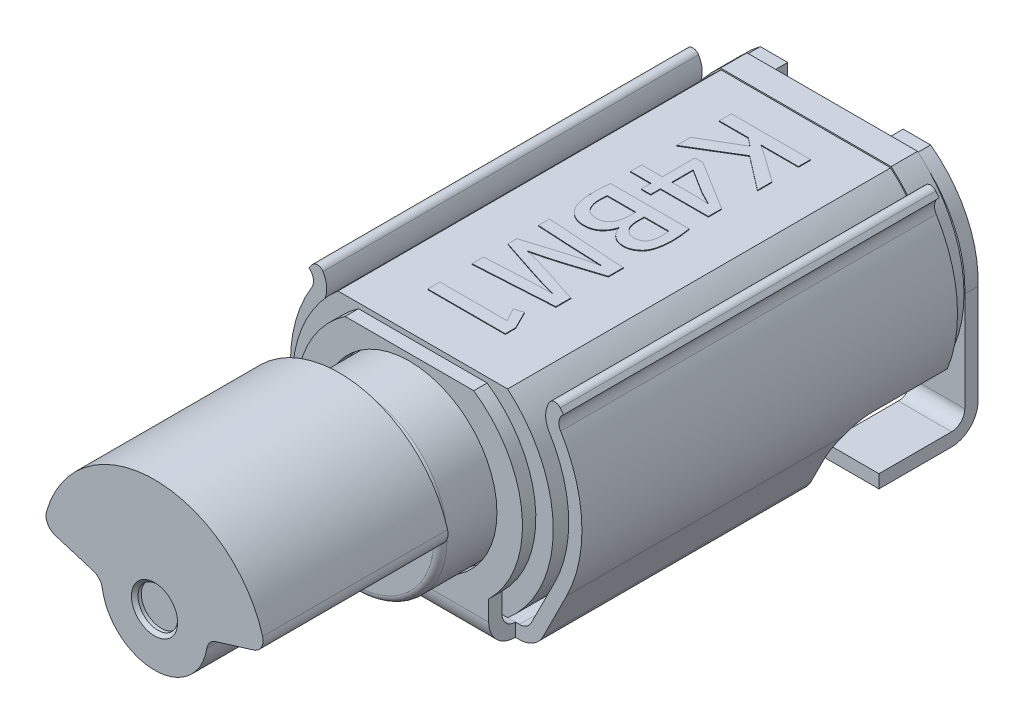
from build123d import *

# Parameters (mm, degrees)
BOSS_EXTRUDE1_DEPTH     = 6.5
CUT_EXTRUDE1_DEPTH      = 8.678373415
CUT_EXTRUDE1_DEPTH_BACK = 8.678373415
SKETCH2_W               = 0.404960927
SKETCH2_H               = 3.440393314
BOSS_EXTRUDE2_DEPTH     = 1.2
BOSS_EXTRUDE3_DEPTH     = 0.202480463
SKETCH7_W               = 0.9
SKETCH7_H               = 0.2
BOSS_EXTRUDE4_DEPTH     = 1.6
FILLET1_R               = 0.4
FILLET2_R               = 0.2
FILLET3_R               = 0.1
FILLET4_R               = 0.4
BOSS_EXTRUDE5_DEPTH     = 5.8
SKETCH11_R              = 0.35
BOSS_EXTRUDE6_DEPTH     = 2.8
SKETCH12_R              = 0.3
CUT_EXTRUDE2_DEPTH      = 0.1
CHAMFER1_SIZE           = 0.05
FILLET5_R               = 0.2
BOSS_EXTRUDE7_DEPTH     = 0.4
SKETCH14_R              = 0.322221407
SKETCH14_R_2            = 0.196605944
SKETCH14_R_3            = 0.3
BOSS_EXTRUDE8_DEPTH     = 0.4
SKETCH15_R              = 0.225672788
BOSS_EXTRUDE9_DEPTH     = 0.2
SKETCH16_W              = 0.807059616
SKETCH16_H              = 0.2
BOSS_EXTRUDE10_DEPTH    = 1.3
FILLET6_R               = 0.2
FILLET7_R               = 0.4
CHAMFER2_SIZE           = 0.05
WRAP1_DEPTH             = 0.01


# Read off the part's stored shape, not the designer's step: Wrap1
with BuildPart() as part:
    # Sketch1 → Boss-Extrude1 (new body)
    with BuildSketch(Plane.XY):
        with BuildLine():
            Line((-1.508880981, 0), (0, 0))
            Line((0, 0), (1.508880981, 0))
            Line((1.508880981, 0), (1.976611203, 0.933111573))
            ThreePointArc((1.976611203, 0.933111573), (2.205012611, 2.001424728), (1.884851065, 3.045913495))
            ThreePointArc((1.884851065, 3.045913495), (1.861209786, 3.172245294), (1.928161236, 3.281954623))
            Line((1.928161236, 3.281954623), (1.806107227, 3.440393314))
            ThreePointArc((1.806107227, 3.440393314), (1.664493793, 3.208339865), (1.714499023, 2.941127131))
            ThreePointArc((1.714499023, 2.941127131), (2.005200965, 1.992746799), (1.79781587, 1.022734276))
            Line((1.79781587, 1.022734276), (1.385413219, 0.2))
            Line((1.385413219, 0.2), (0, 0.2))
            Line((0, 0.2), (-1.385413219, 0.2))
            Line((-1.385413219, 0.2), (-1.79781587, 1.022734276))
            ThreePointArc((-1.79781587, 1.022734276), (-2.005200965, 1.992746799), (-1.714499023, 2.941127131))
            ThreePointArc((-1.714499023, 2.941127131), (-1.664493793, 3.208339865), (-1.806107227, 3.440393314))
            Line((-1.806107227, 3.440393314), (-1.928161236, 3.281954623))
            ThreePointArc((-1.928161236, 3.281954623), (-1.861209786, 3.172245294), (-1.884851065, 3.045913495))
            ThreePointArc((-1.884851065, 3.045913495), (-2.205012611, 2.001424728), (-1.976611203, 0.933111573))
            Line((-1.976611203, 0.933111573), (-1.508880981, 0))
        make_face()
    extrude(amount=BOSS_EXTRUDE1_DEPTH)

    # Sketch2 → Cut-Extrude1 (cut, two sides: drawn at the far end of the back side and taken through both)
    with BuildSketch(Plane(origin=(0, 0, 0), x_dir=(0, 0, -1), z_dir=(1, 0, 0)).offset(-CUT_EXTRUDE1_DEPTH_BACK)):
        with Locations((-6.297519537, 1.720196657)):
            Rectangle(SKETCH2_W, SKETCH2_H)
        with BuildLine():
            Line((-2.039263389, 0), (-2.039263389, 0.604078282))
            ThreePointArc((-2.039263389, 0.604078282), (-1.89281678, 0.957631672), (-1.539263389, 1.104078282))
            Line((-1.539263389, 1.104078282), (-0.407698677, 1.104078282))
            Line((-0.407698677, 1.104078282), (-0.407698677, 3.440393314))
            Line((-0.407698677, 3.440393314), (0, 3.440393314))
            Line((0, 3.440393314), (0, 0))
            Line((0, 0), (-2.039263389, 0))
        make_face()
    extrude(amount=CUT_EXTRUDE1_DEPTH + CUT_EXTRUDE1_DEPTH_BACK, mode=Mode.SUBTRACT)

    # Sketch5 → Boss-Extrude2 (add, symmetric)
    with BuildSketch(Plane(origin=(0, 0, 0), x_dir=(0, 0, -1), z_dir=(1, 0, 0))):
        Polygon((-6.095039073, 0), (-6.5, 0), (-6.5, 0.5), (-6.297519537, 0.5), (-6.297519537, 0.2), (-6.095039073, 0.2), align=None)
    extrude(amount=BOSS_EXTRUDE2_DEPTH, both=True)

    # Sketch6 → Boss-Extrude3 (add)
    with BuildSketch(Plane.XY.offset(6.5)):
        with BuildLine():
            Line((-1.2, 0.705707789), (-1.2, 0.5))
            Line((-1.2, 0.5), (0, 0.5))
            Line((0, 0.5), (0, 0.57516784))
            ThreePointArc((0, 0.57516784), (-1.325, 1.90016784), (0, 3.22516784))
            Line((0, 3.22516784), (0, 3.323129085))
            Line((0, 3.323129085), (-0.973891978, 3.323129085))
            ThreePointArc((-0.973891978, 3.323129085), (-1.705524405, 2.067854826), (-1.2, 0.705707789))
        make_face()
        with BuildLine():
            Line((0, 0.57516784), (0, 0.5))
            Line((0, 0.5), (1.2, 0.5))
            Line((1.2, 0.5), (1.2, 0.705707789))
            ThreePointArc((1.2, 0.705707789), (1.705524405, 2.067854826), (0.973891978, 3.323129085))
            Line((0.973891978, 3.323129085), (0, 3.323129085))
            Line((0, 3.323129085), (0, 3.22516784))
            ThreePointArc((0, 3.22516784), (0.936916485, 2.837084325), (1.325, 1.90016784))
            ThreePointArc((1.325, 1.90016784), (0.936916485, 0.963251355), (0, 0.57516784))
        make_face()
    extrude(amount=-BOSS_EXTRUDE3_DEPTH)

    # Sketch7 → Boss-Extrude4 (add)
    with BuildSketch(Plane(origin=(0, 0, 2.039263389), x_dir=(-1, 0, 0), z_dir=(0, 0, -1))):
        with Locations((0, 0.1)):
            Rectangle(SKETCH7_W, SKETCH7_H)
    extrude(amount=BOSS_EXTRUDE4_DEPTH)

    # Fillet1
    fillet1_edges = [part.edges().sort_by_distance(p)[0] for p in [
        (0, 0, 6.5),
        (1.508880981, 0, 4.067151231),
        (-1.508880981, 0, 4.067151231),
    ]]
    fillet(fillet1_edges, radius=FILLET1_R)

    # Fillet2
    fillet2_edges = [part.edges().sort_by_distance(p)[0] for p in [
        (0, 0.2, 6.297519537),
        (-1.385413219, 0.2, 4.067151231),
        (1.385413219, 0.2, 4.067151231),
    ]]
    fillet(fillet2_edges, radius=FILLET2_R)

    # Fillet3
    fillet3_edges = [part.edges().sort_by_distance(p)[0] for p in [
        (-1.806107227, 3.440393314, 3.251368875),
        (1.806107227, 3.440393314, 3.251368875),
    ]]
    fillet(fillet3_edges, radius=FILLET3_R)

    # Fillet4
    fillet4_edges = [part.edges().sort_by_distance(p)[0] for p in [
        (0.45, 0.1, 2.039263389),
        (-0.45, 0.1, 2.039263389),
    ]]
    fillet(fillet4_edges, radius=FILLET4_R)

    # Sketch9 → Boss-Extrude5 (add)
    with BuildSketch(Plane(origin=(0, 0, 6.297519537), x_dir=(-1, 0, 0), z_dir=(0, 0, -1))):
        with BuildLine():
            Line((1.284766516, 3.40016784), (-1.284766516, 3.40016784))
            ThreePointArc((-1.284766516, 3.40016784), (-1.975, 1.90016784), (-1.284766516, 0.40016784))
            Line((-1.284766516, 0.40016784), (1.284766516, 0.40016784))
            ThreePointArc((1.284766516, 0.40016784), (1.975, 1.90016784), (1.284766516, 3.40016784))
        make_face()
    extrude(amount=BOSS_EXTRUDE5_DEPTH)

    # Sketch10 → Revolve1 (revolve)
    with BuildSketch(Plane(origin=(0, 0, 0), x_dir=(0, 0, -1), z_dir=(1, 0, 0)), mode=Mode.PRIVATE) as revolve1_sk:
        with BuildLine():
            Line((-6.297519537, 3.20016784), (-7.230821667, 3.20016784))
            ThreePointArc((-7.230821667, 3.20016784), (-7.301532345, 3.170878518), (-7.330821667, 3.10016784))
            Line((-7.330821667, 3.10016784), (-7.330821667, 2.25016784))
            Line((-7.330821667, 2.25016784), (-10.359848514, 2.25016784))
            Line((-10.359848514, 2.25016784), (-10.359848514, 1.90016784))
            Line((-10.359848514, 1.90016784), (-6.297519537, 1.90016784))
            Line((-6.297519537, 1.90016784), (-6.297519537, 3.20016784))
        make_face()
    revolve(revolve1_sk.sketch.rotate(Axis((0, 1.90016784, 10.359848514), (0, 0, -1)), 180), axis=Axis((0, 1.90016784, 10.359848514), (0, 0, -1)))

    # Sketch11 → Boss-Extrude6 (add)
    with BuildSketch(Plane.XY.offset(10.359848514)):
        with BuildLine():
            Line((0.8, 1.90016784), (1.678413738, 2.170218436))
            ThreePointArc((1.678413738, 2.170218436), (0, 3.60016784), (-1.678413738, 2.170218436))
            Line((-1.678413738, 2.170218436), (-0.8, 1.90016784))
            ThreePointArc((-0.8, 1.90016784), (0, 1.10016784), (0.8, 1.90016784))
        make_face()
        with Locations(Location((0, 1.90016784, 0), (0, 0, 270))):
            Circle(SKETCH11_R, mode=Mode.SUBTRACT)
    extrude(amount=-BOSS_EXTRUDE6_DEPTH)

    # Sketch12 → Cut-Extrude2 (cut)
    with BuildSketch(Plane.XY.offset(10.359848514)):
        with Locations((0, 1.90016784)):
            Circle(SKETCH12_R)
    extrude(amount=-CUT_EXTRUDE2_DEPTH, mode=Mode.SUBTRACT)

    # Chamfer1
    chamfer1_edges = [part.edges().sort_by_distance(p)[0] for p in [
        (-0.3, 1.90016784, 10.359848514),
    ]]
    chamfer(chamfer1_edges, length=CHAMFER1_SIZE)

    # Fillet5
    fillet5_edges = [part.edges().sort_by_distance(p)[0] for p in [
        (0.8, 1.90016784, 8.959848514),
        (-0.8, 1.90016784, 8.959848514),
        (-1.678413738, 2.170218436, 8.959848514),
        (1.678413738, 2.170218436, 8.959848514),
    ]]
    fillet(fillet5_edges, radius=FILLET5_R)

    # Sketch13 → Boss-Extrude7 (add)
    with BuildSketch(Plane(origin=(0, 0, 0.497519537), x_dir=(-1, 0, 0), z_dir=(0, 0, -1))):
        with BuildLine():
            Line((1.292139698, 3.42016784), (-1.292139698, 3.42016784))
            ThreePointArc((-1.292139698, 3.42016784), (-1.995, 1.90016784), (-1.292139698, 0.38016784))
            Line((-1.292139698, 0.38016784), (1.292139698, 0.38016784))
            ThreePointArc((1.292139698, 0.38016784), (1.995, 1.90016784), (1.292139698, 3.42016784))
        make_face()
    extrude(amount=BOSS_EXTRUDE7_DEPTH)

    # Sketch14 → Boss-Extrude8 (add)
    # profile 1 of 4: a face of its own
    with BuildSketch(Plane(origin=(0, 0, 0.097519537), x_dir=(-1, 0, 0), z_dir=(0, 0, -1))):
        with BuildLine():
            Line((0.874363241, 2.446594123), (0.874363241, 1.353741556))
            ThreePointArc((0.874363241, 1.353741556), (0, 0.869103942), (-0.874363241, 1.353741556))
            Line((-0.874363241, 1.353741556), (-0.874363241, 2.446594123))
            ThreePointArc((-0.874363241, 2.446594123), (0, 2.931231737), (0.874363241, 2.446594123))
        make_face()
        with Locations((0, 1.90016784)):
            Circle(SKETCH14_R, mode=Mode.SUBTRACT)
    # profile 2 of 4: a face of its own
    with BuildSketch(Plane(origin=(0, 0, 0.097519537), x_dir=(-1, 0, 0), z_dir=(0, 0, -1))):
        with Locations((1.305297869, 2.606990559)):
            Circle(SKETCH14_R_2)
    # profile 3 of 4: a face of its own
    with BuildSketch(Plane(origin=(0, 0, 0.097519537), x_dir=(-1, 0, 0), z_dir=(0, 0, -1))):
        with Locations((-1.319866553, 1.220938008)):
            Circle(SKETCH14_R_2)
    # profile 4 of 4: a face of its own
    with BuildSketch(Plane(origin=(0, 0, 0.097519537), x_dir=(-1, 0, 0), z_dir=(0, 0, -1))):
        with Locations(Location((0, 1.90016784, 0), (0, 0, 180))):
            Circle(SKETCH14_R_3)
    extrude(amount=BOSS_EXTRUDE8_DEPTH)

    # Sketch15 → Boss-Extrude9 (add)
    # profile 1 of 2: a face of its own
    with BuildSketch(Plane(origin=(0, 0, 0.097519537), x_dir=(-1, 0, 0), z_dir=(0, 0, -1))):
        with BuildLine():
            Line((-0.874363241, 1.353741556), (-0.874363241, 3.40271883))
            Line((-0.874363241, 3.40271883), (-1.289526835, 3.40271883))
            ThreePointArc((-1.289526835, 3.40271883), (-1.834590395, 2.744294855), (-2.007059616, 1.907114599))
            Line((-2.007059616, 1.907114599), (-2.007059616, 0))
            Line((-2.007059616, 0), (-1.2, 0))
            Line((-1.2, 0), (-1.2, 0.502925736))
            ThreePointArc((-1.2, 0.502925736), (-1.112132034, 0.715057771), (-0.9, 0.802925736))
            Line((-0.9, 0.802925736), (-0.787371765, 0.802925736))
            ThreePointArc((-0.787371765, 0.802925736), (-0.716661087, 0.832215058), (-0.687371765, 0.902925736))
            Line((-0.687371765, 0.902925736), (-0.687371765, 1.131654459))
            ThreePointArc((-0.687371765, 1.131654459), (-0.78872348, 1.236083483), (-0.874363241, 1.353741556))
        make_face()
        with Locations((-1.319866553, 1.220938008)):
            Circle(SKETCH15_R, mode=Mode.SUBTRACT)
    # profile 2 of 2: a face of its own
    with BuildSketch(Plane(origin=(0, 0, 0.097519537), x_dir=(-1, 0, 0), z_dir=(0, 0, -1))):
        with BuildLine():
            Line((0.874363241, 1.353741556), (0.874363241, 3.40271883))
            Line((0.874363241, 3.40271883), (1.289526835, 3.40271883))
            ThreePointArc((1.289526835, 3.40271883), (1.834590395, 2.744294855), (2.007059616, 1.907114599))
            Line((2.007059616, 1.907114599), (2.007059616, 0))
            Line((2.007059616, 0), (1.2, 0))
            Line((1.2, 0), (1.2, 0.502925736))
            ThreePointArc((1.2, 0.502925736), (1.112132034, 0.715057771), (0.9, 0.802925736))
            Line((0.9, 0.802925736), (0.787371765, 0.802925736))
            ThreePointArc((0.787371765, 0.802925736), (0.716661087, 0.832215058), (0.687371765, 0.902925736))
            Line((0.687371765, 0.902925736), (0.687371765, 1.131654459))
            ThreePointArc((0.687371765, 1.131654459), (0.78872348, 1.236083483), (0.874363241, 1.353741556))
        make_face()
        with Locations((1.305297869, 2.606990559)):
            Circle(SKETCH15_R, mode=Mode.SUBTRACT)
    extrude(amount=BOSS_EXTRUDE9_DEPTH)

    # Sketch16 → Boss-Extrude10 (add)
    with BuildSketch(Plane.XY.offset(0.097519537)):
        with Locations((-1.603529808, 0.1)):
            Rectangle(SKETCH16_W, SKETCH16_H)
        with Locations((1.603529808, 0.1)):
            Rectangle(SKETCH16_W, SKETCH16_H)
    extrude(amount=BOSS_EXTRUDE10_DEPTH)

    # Fillet6
    # the kernel refuses this fillet: 0.2 mm, written as the material it adds along each edge
    with BuildSketch(Plane(origin=(-1.2, 0.2, 0.097519537), x_dir=(0, 1, 0), z_dir=(-1, 0, 0))) as fillet6_piece_1:
        with BuildLine():
            CenterArc((FILLET6_R, -FILLET6_R), FILLET6_R, 90, 90)
            Line((0, -FILLET6_R), (0, 0))
            Line((0, 0), (FILLET6_R, 0))
        make_face()
    extrude(amount=0.807059616)
    with BuildSketch(Plane(origin=(1.2, 0.2, 0.097519537), x_dir=(0, 1, 0), z_dir=(1, 0, 0))) as fillet6_piece_2:
        with BuildLine():
            CenterArc((FILLET6_R, FILLET6_R), FILLET6_R, 180, 90)
            Line((0, FILLET6_R), (0, 0))
            Line((0, 0), (FILLET6_R, 0))
        make_face()
    extrude(amount=0.807059616)

    # Fillet7
    fillet7_edges = [part.edges().sort_by_distance(p)[0] for p in [
        (1.603529808, 0, -0.102480463),
        (-1.603529808, 0, -0.102480463),
    ]]
    fillet(fillet7_edges, radius=FILLET7_R)

    # Chamfer2
    chamfer2_edges = [part.edges().sort_by_distance(p)[0] for p in [
        (-0.3, 1.90016784, -0.302480463),
    ]]
    chamfer(chamfer2_edges, length=CHAMFER2_SIZE)

    # Wrap1 outline → Wrap1 (add)
    # profile 1 of 5: a face of its own
    with BuildSketch(Plane(origin=(0, 3.40016784, 0), x_dir=(1, 0, 0), z_dir=(0, 1, 0))):
        with BuildLine():
            Line((0.580006511, -1.589035731), (0.150238548, -1.280263442))
            add(Edge.make_bspline(
                [(0.150238548, -1.280263442), (0.128647408, -1.265784022), (0.084655949, -1.236282533), (0.039655444, -1.208343991), (0.016741322, -1.194117769)],
                knots=[0, 0, 0, 0, 0.490803005, 1, 1, 1, 1], degree=3))
            Line((0.016741322, -1.194117769), (0.016898989, -1.189355864))
            Line((0.016898989, -1.189355864), (0.580006511, -1.189355864))
            Line((0.580006511, -1.189355864), (0.580006511, -1.005228624))
            Line((0.580006511, -1.005228624), (-0.619993489, -1.005228624))
            Line((-0.619993489, -1.005228624), (-0.619993489, -1.189355864))
            Line((-0.619993489, -1.189355864), (-0.179188596, -1.189355864))
            Line((-0.179188596, -1.189355864), (-0.053692541, -1.289667674))
            Line((-0.053692541, -1.289667674), (-0.619993489, -1.621950544))
            Line((-0.619993489, -1.621950544), (-0.619993489, -1.833545768))
            Line((-0.619993489, -1.833545768), (0.068666112, -1.416624808))
            Line((0.068666112, -1.416624808), (0.580006511, -1.810035188))
            Line((0.580006511, -1.810035188), (0.580006511, -1.589035731))
        make_face()
    # profile 2 of 5: a face of its own
    with BuildSketch(Plane(origin=(0, 3.40016784, 0), x_dir=(1, 0, 0), z_dir=(0, 1, 0))):
        with BuildLine():
            add(Edge.make_bspline(
                [(0.024005974, -3.349503212), (0.026979131, -3.357698037), (0.032791256, -3.373717824), (0.04339851, -3.396396838), (0.054668003, -3.417746101), (0.067471196, -3.437387277), (0.081057724, -3.455889499), (0.09578692, -3.472931528), (0.111705141, -3.488427154), (0.128710496, -3.502199355), (0.146506198, -3.514457072), (0.164801832, -3.525444377), (0.183876125, -3.5345205), (0.203592024, -3.541726341), (0.223757824, -3.547786615), (0.244664447, -3.551726186), (0.266108434, -3.554345145), (0.280603419, -3.554706303), (0.287943186, -3.55488918)],
                knots=[0, 0, 0, 0, 0.072925694, 0.142559987, 0.209357685, 0.274811788, 0.338581105, 0.401366938, 0.463105034, 0.524263478, 0.584279167, 0.643843037, 0.702700585, 0.760750232, 0.819406848, 0.878711473, 0.938583619, 1, 1, 1, 1], degree=3))
            add(Edge.make_bspline(
                [(0.287943186, -3.55488918), (0.296262217, -3.555251163), (0.313015632, -3.555980148), (0.338182361, -3.553212983), (0.363419557, -3.548122448), (0.38838995, -3.539462738), (0.413593156, -3.528326633), (0.438626102, -3.513959469), (0.463663835, -3.496759117), (0.488857405, -3.476992188), (0.512965737, -3.45263598), (0.533560504, -3.421847808), (0.551064685, -3.385410303), (0.566058791, -3.343479963), (0.577470588, -3.295676114), (0.586835337, -3.242393013), (0.592751413, -3.1831966), (0.594507913, -3.141824925), (0.595426236, -3.120195222)],
                knots=[0, 0, 0, 0, 0.041411388, 0.083396993, 0.125696939, 0.169380999, 0.21470772, 0.262749144, 0.312861918, 0.365885607, 0.422050724, 0.482709173, 0.549371117, 0.622950342, 0.704017343, 0.793808662, 0.892200225, 1, 1, 1, 1], degree=3))
            add(Edge.make_bspline(
                [(0.595426236, -3.120195222), (0.595003583, -3.093201994), (0.594177529, -3.040445146), (0.589528265, -2.975654541), (0.584286861, -2.926731456), (0.580129661, -2.89320341), (0.575069333, -2.86253552), (0.571351926, -2.843090635), (0.569575891, -2.833800612)],
                knots=[0, 0, 0, 0, 0.281194462, 0.549579805, 0.676274439, 0.793767423, 0.901469944, 1, 1, 1, 1], degree=3))
            Line((0.569575891, -2.833800612), (-0.62110336, -2.83380039))
            add(Edge.make_bspline(
                [(-0.62110336, -2.83380039), (-0.622149488, -2.840898643), (-0.624359289, -2.855892734), (-0.626684471, -2.879815251), (-0.629054388, -2.906260128), (-0.630665728, -2.935387427), (-0.632664792, -2.967116701), (-0.633860255, -3.001522058), (-0.635105791, -3.038479756), (-0.635457951, -3.063958278), (-0.635639751, -3.077111314)],
                knots=[0, 0, 0, 0, 0.088238411, 0.186391627, 0.29556366, 0.414798057, 0.545169041, 0.686594205, 0.838207345, 1, 1, 1, 1], degree=3))
            add(Edge.make_bspline(
                [(-0.635639751, -3.077111314), (-0.635659844, -3.089055883), (-0.635699281, -3.112500148), (-0.634129967, -3.14696831), (-0.632294955, -3.180110655), (-0.629058402, -3.211868427), (-0.624945555, -3.242175974), (-0.620297374, -3.271192529), (-0.614385529, -3.298716979), (-0.607617022, -3.324910329), (-0.599817959, -3.349598302), (-0.591636169, -3.373051667), (-0.581921792, -3.394909665), (-0.571628073, -3.415504408), (-0.560260663, -3.43473532), (-0.547707285, -3.452316816), (-0.534637765, -3.468847693), (-0.524992668, -3.478775183), (-0.520220228, -3.483687353)],
                knots=[0, 0, 0, 0, 0.082672515, 0.162265912, 0.238802977, 0.312420989, 0.383163987, 0.450516937, 0.515784915, 0.577970481, 0.637713091, 0.694977861, 0.74980512, 0.803156958, 0.85430552, 0.904243471, 0.952619211, 1, 1, 1, 1], degree=3))
            add(Edge.make_bspline(
                [(-0.520220228, -3.483687353), (-0.514673573, -3.489488077), (-0.503066861, -3.501626443), (-0.482191785, -3.518068515), (-0.458175166, -3.534611201), (-0.430590627, -3.550845219), (-0.398818332, -3.565185226), (-0.362157897, -3.575053038), (-0.321302593, -3.582002037), (-0.29243639, -3.583258191), (-0.27736304, -3.583914129)],
                knots=[0, 0, 0, 0, 0.088975791, 0.186187243, 0.294154312, 0.412566051, 0.54100935, 0.679628949, 0.832708687, 1, 1, 1, 1], degree=3))
            add(Edge.make_bspline(
                [(-0.27736304, -3.583914129), (-0.267074273, -3.583441918), (-0.24704344, -3.582522588), (-0.217817574, -3.578965024), (-0.190290204, -3.573047053), (-0.164371748, -3.565078046), (-0.139962603, -3.555345381), (-0.117117197, -3.543618274), (-0.096235095, -3.529372809), (-0.076897478, -3.51348646), (-0.059342269, -3.495998053), (-0.043245701, -3.477631631), (-0.028607921, -3.458520781), (-0.015676986, -3.438490798), (-0.004220347, -3.417637115), (0.00517231, -3.395674601), (0.013538852, -3.373123473), (0.01748508, -3.357501438), (0.019462411, -3.349673723)],
                knots=[0, 0, 0, 0, 0.075367478, 0.146730242, 0.21519733, 0.281169393, 0.344964617, 0.407318749, 0.468693359, 0.52960999, 0.59024462, 0.64983298, 0.708254302, 0.766257657, 0.824184453, 0.882153502, 0.940950796, 1, 1, 1, 1], degree=3))
            Line((0.019462411, -3.349673723), (0.024005974, -3.349503212))
        make_face()
        with BuildLine():
            Line((-0.055367756, -3.01792763), (-0.055367756, -3.124884938))
            add(Edge.make_bspline(
                [(-0.055367756, -3.124884938), (-0.055507593, -3.133754716), (-0.055783689, -3.151267385), (-0.057695982, -3.177154842), (-0.061724606, -3.202101256), (-0.066728946, -3.226284867), (-0.074001205, -3.249436629), (-0.082184007, -3.272014857), (-0.092611054, -3.293574889), (-0.104094632, -3.314375025), (-0.117694135, -3.333534819), (-0.133406554, -3.350566792), (-0.151576206, -3.364878148), (-0.171643073, -3.377016465), (-0.193922064, -3.386600244), (-0.218314291, -3.393545368), (-0.244783608, -3.398084343), (-0.263135183, -3.399207681), (-0.272601135, -3.399787111)],
                knots=[0, 0, 0, 0, 0.067331507, 0.132940679, 0.196800637, 0.259031592, 0.320195499, 0.380832412, 0.441142733, 0.501774217, 0.560999563, 0.619048845, 0.677021524, 0.735959941, 0.796604997, 0.860519054, 0.928054137, 1, 1, 1, 1], degree=3))
            add(Edge.make_bspline(
                [(-0.272601135, -3.399787111), (-0.282142716, -3.399292013), (-0.300563041, -3.39833621), (-0.327140275, -3.393922324), (-0.351652727, -3.387468939), (-0.374193002, -3.378623998), (-0.394499039, -3.367170563), (-0.41281999, -3.35355035), (-0.428915827, -3.337359296), (-0.442843923, -3.319033433), (-0.454754505, -3.298949442), (-0.46524696, -3.277808036), (-0.474077399, -3.255499286), (-0.481362045, -3.232171744), (-0.486796576, -3.207659727), (-0.490559387, -3.182121609), (-0.492974972, -3.155465082), (-0.492997738, -3.137358542), (-0.493009339, -3.128131732)],
                knots=[0, 0, 0, 0, 0.072289283, 0.139556765, 0.203550895, 0.263910766, 0.322329614, 0.37955626, 0.436207749, 0.494581733, 0.553369405, 0.612744635, 0.673104506, 0.734827098, 0.797581015, 0.862974822, 0.930174111, 1, 1, 1, 1], degree=3))
            add(Edge.make_bspline(
                [(-0.493009339, -3.128131732), (-0.493010083, -3.117019106), (-0.493011485, -3.096071949), (-0.491866972, -3.066578302), (-0.49004151, -3.040900304), (-0.487726768, -3.025174231), (-0.486660131, -3.01792763)],
                knots=[0, 0, 0, 0, 0.30164842, 0.56860339, 0.801211705, 1, 1, 1, 1], degree=3))
            Line((-0.486660131, -3.01792763), (-0.055367756, -3.01792763))
        make_face(mode=Mode.SUBTRACT)
        with BuildLine():
            Line((0.073430454, -3.01792763), (0.443319845, -3.01792763))
            add(Edge.make_bspline(
                [(0.443319845, -3.01792763), (0.444009533, -3.020794041), (0.445507428, -3.027019435), (0.447377034, -3.037373666), (0.448509982, -3.049521186), (0.449998468, -3.063410356), (0.451038377, -3.07899292), (0.452045633, -3.096374089), (0.452322943, -3.11550993), (0.452634098, -3.12888803), (0.452795824, -3.135841484)],
                knots=[0, 0, 0, 0, 0.0746234, 0.162070275, 0.266022372, 0.383294734, 0.515656155, 0.661265535, 0.823938053, 1, 1, 1, 1], degree=3))
            add(Edge.make_bspline(
                [(0.452795824, -3.135841484), (0.452740764, -3.150681274), (0.452633678, -3.17954291), (0.445812613, -3.221657825), (0.434038452, -3.261031424), (0.420105011, -3.291753549), (0.405582357, -3.313839953), (0.392628288, -3.328565249), (0.377135797, -3.340918239), (0.359525755, -3.351129138), (0.339840008, -3.359279432), (0.31809535, -3.365455883), (0.294103867, -3.369178787), (0.277373144, -3.370220303), (0.268668806, -3.370762162)],
                knots=[0, 0, 0, 0, 0.130735434, 0.254264952, 0.374702623, 0.492513413, 0.550205568, 0.607344188, 0.664715711, 0.724175948, 0.786333472, 0.852178839, 0.923094464, 1, 1, 1, 1], degree=3))
            add(Edge.make_bspline(
                [(0.268668806, -3.370762162), (0.261625743, -3.370448467), (0.247773818, -3.36983151), (0.227519504, -3.366519257), (0.208152814, -3.361780517), (0.190091363, -3.354261015), (0.172991332, -3.34517109), (0.156768881, -3.334279106), (0.141728978, -3.321231804), (0.127967352, -3.306264649), (0.115474039, -3.289610841), (0.104258186, -3.271490179), (0.095052119, -3.251631327), (0.087347067, -3.230462672), (0.081081873, -3.207817586), (0.077061363, -3.183559353), (0.07387537, -3.157917418), (0.073431143, -3.140311776), (0.073203918, -3.131306336)],
                knots=[0, 0, 0, 0, 0.060964225, 0.119901211, 0.177337871, 0.23309597, 0.288700359, 0.344764613, 0.401812525, 0.460604113, 0.520395329, 0.581765334, 0.644681321, 0.709457295, 0.776585392, 0.847676469, 0.92208517, 1, 1, 1, 1], degree=3))
            Line((0.073203918, -3.131306336), (0.073430454, -3.01792763))
        make_face(mode=Mode.SUBTRACT)
    # profile 3 of 5: a face of its own
    with BuildSketch(Plane(origin=(0, 3.40016784, 0), x_dir=(1, 0, 0), z_dir=(0, 1, 0))):
        with BuildLine():
            Line((0.580214667, -4.636835374), (0.052836496, -4.463594484))
            add(Edge.make_bspline(
                [(0.052836496, -4.463594484), (0.016348042, -4.452419395), (-0.055095067, -4.430538965), (-0.160649707, -4.40024369), (-0.262450122, -4.373472262), (-0.329261066, -4.357491403), (-0.361943555, -4.349673907)],
                knots=[0, 0, 0, 0, 0.266093049, 0.521000821, 0.76568382, 1, 1, 1, 1], degree=3))
            Line((-0.361943555, -4.349673907), (-0.361943555, -4.344979099))
            add(Edge.make_bspline(
                [(-0.361943555, -4.344979099), (-0.328951784, -4.337396555), (-0.261815071, -4.321966431), (-0.160089417, -4.295593745), (-0.055244304, -4.267199379), (0.01534313, -4.246406501), (0.051208449, -4.235841687)],
                knots=[0, 0, 0, 0, 0.237600064, 0.483505044, 0.737570062, 1, 1, 1, 1], degree=3))
            Line((0.051208449, -4.235841687), (0.580214667, -4.067169382))
            Line((0.580214667, -4.067169382), (0.580214667, -3.842424443))
            Line((0.580214667, -3.842424443), (-0.617813163, -3.761238203))
            Line((-0.617813163, -3.761238203), (-0.617813163, -3.929825252))
            Line((-0.617813163, -3.929825252), (-0.126273071, -3.956357641))
            add(Edge.make_bspline(
                [(-0.126273071, -3.956357641), (-0.083214311, -3.958700162), (0.0036704, -3.963426941), (0.112265165, -3.968794272), (0.198826197, -3.972301943), (0.261627301, -3.974960844), (0.322181948, -3.976646274), (0.36171494, -3.977718434), (0.381140482, -3.978245267)],
                knots=[0, 0, 0, 0, 0.254706995, 0.513952174, 0.64219657, 0.766408045, 0.885218639, 1, 1, 1, 1], degree=3))
            Line((0.381140482, -3.978245267), (0.381158419, -3.98289003))
            add(Edge.make_bspline(
                [(0.381158419, -3.98289003), (0.344069604, -3.99097114), (0.268843809, -4.007361739), (0.155345117, -4.035970725), (0.039359552, -4.067512519), (-0.038268705, -4.09119348), (-0.077589761, -4.103188601)],
                knots=[0, 0, 0, 0, 0.240017351, 0.486817809, 0.740057727, 1, 1, 1, 1], degree=3))
            Line((-0.077589761, -4.103188601), (-0.606841559, -4.266942662))
            Line((-0.606841559, -4.266942662), (-0.606841559, -4.402726062))
            Line((-0.606841559, -4.402726062), (-0.066569882, -4.58064914))
            add(Edge.make_bspline(
                [(-0.066569882, -4.58064914), (-0.02834184, -4.593228959), (0.047340046, -4.618133829), (0.160393487, -4.652379964), (0.271345203, -4.684291534), (0.344824916, -4.703767347), (0.381140482, -4.713392795)],
                knots=[0, 0, 0, 0, 0.25848934, 0.511743719, 0.758691167, 1, 1, 1, 1], degree=3))
            Line((0.381140482, -4.713392795), (0.381158419, -4.717993269))
            add(Edge.make_bspline(
                [(0.381158419, -4.717993269), (0.361877866, -4.718013634), (0.322565666, -4.718055156), (0.262617137, -4.718754632), (0.200627723, -4.720027496), (0.115827857, -4.723292591), (0.009685249, -4.727382318), (-0.075099127, -4.731676465), (-0.117045551, -4.733800962)],
                knots=[0, 0, 0, 0, 0.116026562, 0.236573049, 0.360780705, 0.489132767, 0.747252335, 1, 1, 1, 1], degree=3))
            Line((-0.117045551, -4.733800962), (-0.617813163, -4.760132945))
            Line((-0.617813163, -4.760132945), (-0.617813163, -4.934934565))
            Line((-0.617813163, -4.934934565), (0.580214667, -4.863141043))
            Line((0.580214667, -4.863141043), (0.580214667, -4.636835374))
        make_face()
    # profile 4 of 5: a face of its own
    with BuildSketch(Plane(origin=(0, 3.40016784, 0), x_dir=(1, 0, 0), z_dir=(0, 1, 0))):
        Polygon((-0.316252158, -2.672450756), (-0.173621525, -2.672450756), (-0.173621525, -2.525117785), (0.551595844, -2.525117785), (0.551595844, -2.322926793), (-0.194696677, -1.860552044), (-0.316252158, -1.860552044), (-0.316252158, -2.354274234), (-0.628159192, -2.354274234), (-0.628159192, -2.525117785), (-0.316252158, -2.525117785), align=None)
        with BuildLine():
            Line((-0.170515568, -2.031395595), (0.186669429, -2.257097168))
            add(Edge.make_bspline(
                [(0.186669429, -2.257097168), (0.201974326, -2.265223601), (0.232626749, -2.281499101), (0.279526368, -2.305955268), (0.328952444, -2.330696053), (0.362986595, -2.347357509), (0.380686968, -2.356022746)],
                knots=[0, 0, 0, 0, 0.238688683, 0.478042202, 0.728541854, 1, 1, 1, 1], degree=3))
            Line((0.380686968, -2.356022746), (0.380752293, -2.362111094))
            add(Edge.make_bspline(
                [(0.380752293, -2.362111094), (0.346803776, -2.359933403), (0.279048909, -2.355587141), (0.211159199, -2.354818806), (0.17728557, -2.354435444)],
                knots=[0, 0, 0, 0, 0.501049128, 1, 1, 1, 1], degree=3))
            Line((0.17728557, -2.354435444), (-0.173621525, -2.354274234))
            Line((-0.173621525, -2.354274234), (-0.173621525, -2.031395595))
            Line((-0.173621525, -2.031395595), (-0.170515568, -2.031395595))
        make_face(mode=Mode.SUBTRACT)
    # profile 5 of 5: a face of its own
    with BuildSketch(Plane(origin=(0, 3.40016784, 0), x_dir=(1, 0, 0), z_dir=(0, 1, 0))):
        Polygon((0.552342107, -5.601148061), (0.552342107, -5.441469212), (0.416853446, -5.174078157), (0.284802685, -5.21482983), (0.394518727, -5.413886078), (0.394518727, -5.417020822), (-0.619570976, -5.417020822), (-0.621354034, -5.601148061), align=None)
    extrude(amount=WRAP1_DEPTH)


solid = part.part
